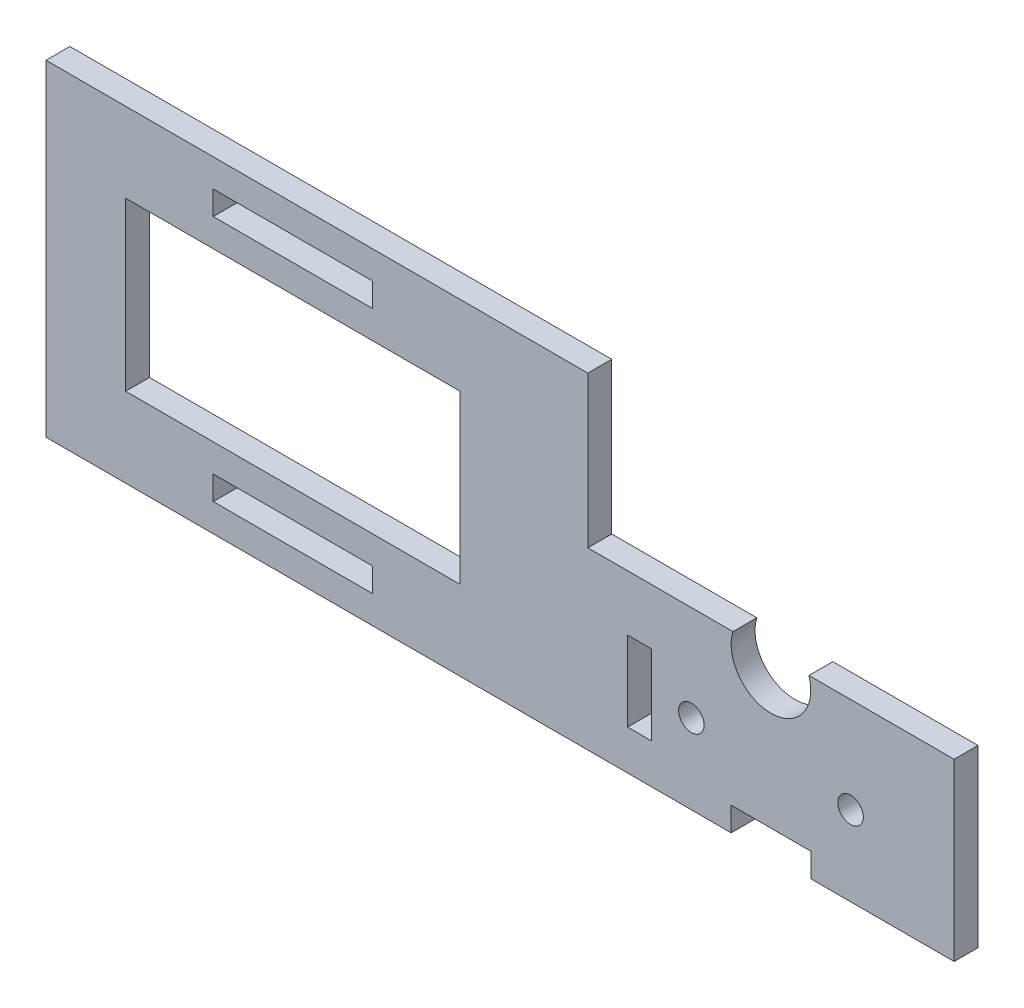
from build123d import *

# Parameters (mm, degrees)
ESBO_O1_W                = 20
ESBO_O1_H                = 3
ESBO_O1_W_2              = 3
ESBO_O1_H_2              = 10
ESBO_O1_R                = 1.6
ESBO_O1_W_3              = 42
ESBO_O1_H_3              = 21
RESSALTO_EXTRUS_O1_DEPTH = 3


with BuildPart() as part:
    # Esboço1 → Ressalto-extrusão1 (new body)
    with BuildSketch(Plane.XY):
        with BuildLine():
            Line((5, 0), (23, 0))
            Line((23, 0), (23, 22))
            Line((23, 22), (4.769696007, 22))
            ThreePointArc((4.769696007, 22), (4.942088629, 21.258788496), (5, 20.5))
            ThreePointArc((5, 20.5), (-0.758788496, 15.557911371), (-4.769696007, 22))
            Line((-4.769696007, 22), (-23, 22))
            Line((-23, 22), (-23, 41))
            Line((-23, 41), (-91.05, 41))
            Line((-91.05, 41), (-91.05, 0))
            Line((-91.05, 0), (-23, 0))
            Line((-23, 0), (-5, 0))
            Line((-5, 0), (-5, 3))
            Line((-5, 3), (5, 3))
            Line((5, 3), (5, 0))
        make_face()
        with Locations((-60.05, 5)):
            Rectangle(ESBO_O1_W, ESBO_O1_H, mode=Mode.SUBTRACT)
        with Locations((-16.5, 10)):
            Rectangle(ESBO_O1_W_2, ESBO_O1_H_2, mode=Mode.SUBTRACT)
        with Locations((-10, 10)):
            Circle(ESBO_O1_R, mode=Mode.SUBTRACT)
        with Locations((10, 10)):
            Circle(ESBO_O1_R, mode=Mode.SUBTRACT)
        with Locations((-60.05, 20.5)):
            Rectangle(ESBO_O1_W_3, ESBO_O1_H_3, mode=Mode.SUBTRACT)
        with Locations((-60.05, 36)):
            Rectangle(ESBO_O1_W, ESBO_O1_H, mode=Mode.SUBTRACT)
    extrude(amount=RESSALTO_EXTRUS_O1_DEPTH)


solid = part.part
